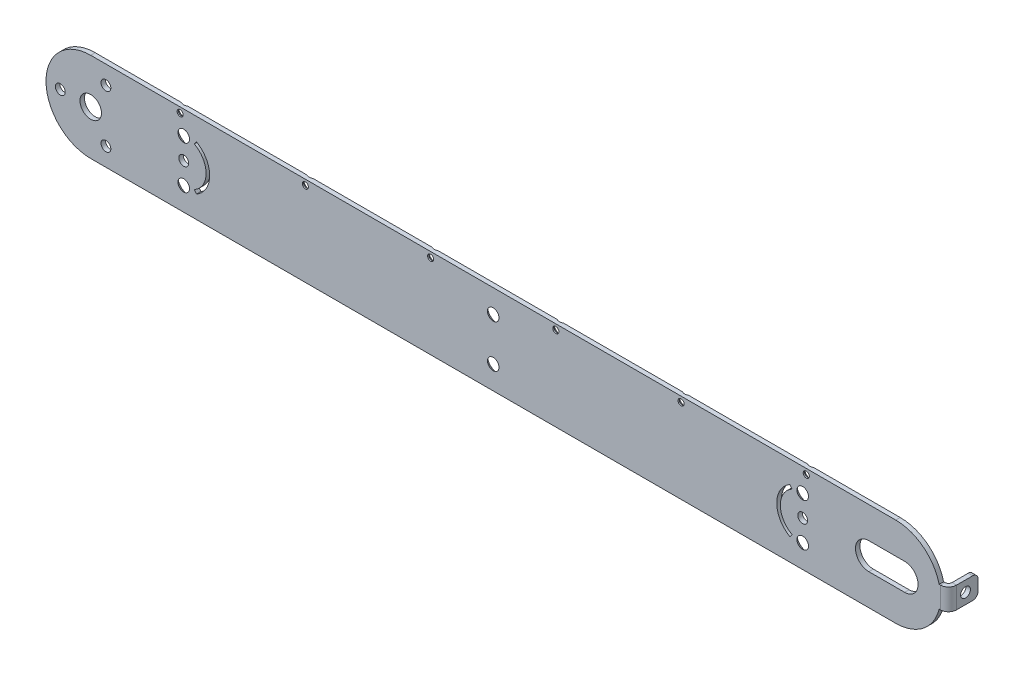
from build123d import *

# Parameters (mm, degrees)
AUFSATZ_LINEAR_START                        = -96.5
AUFSATZ_LINEAR_AUSTRAGEN1_DEPTH             = 2.5
SKIZZE3_W                                   = 2.5
SKIZZE3_H                                   = 6
AUFSATZ_LINEAR_AUSTRAGEN2_DEPTH             = 14
VERRUNDUNG1_R                               = 3
DURCHGANGSLOCH_F_R_M51_D                    = 5.5
KREISMUSTER1_COUNT                          = 3
DURCHGANGSLOCH_F_R_M5_EINSTELLSCHRAUBE_D    = 5.5
VOLUMENK_RPER_START                         = -6
VOLUMENK_RPER_UMWANDELN2_DEPTH              = 12
VOLUMENK_RPER_UMWANDELN2_2_DEPTH            = 12
FORMSENKUNG_F_R_M3_SENKSCHRAUBE_MIT_2_COUNT = 2
FORMSENKUNG_F_R_M3_SENKSCHRAUBE_MIT_2_PITCH = 70
FORMSENKUNG_F_R_M3_SENKSCHRAUBE_MIT_3_COUNT = 2
FORMSENKUNG_F_R_M3_SENKSCHRAUBE_MIT_3_PITCH = 140
FORMSENKUNG_F_R_M3_SENKSCHRAUBE_MIT_4_COUNT = 2
FORMSENKUNG_F_R_M3_SENKSCHRAUBE_MIT_4_PITCH = 210
FORMSENKUNG_F_R_M3_SENKSCHRAUBE_MIT_5_COUNT = 2
FORMSENKUNG_F_R_M3_SENKSCHRAUBE_MIT_5_PITCH = 280
FORMSENKUNG_F_R_M3_SENKSCHRAUBE_MIT_6_COUNT = 2
FORMSENKUNG_F_R_M3_SENKSCHRAUBE_MIT_6_PITCH = 350
FORMSENKUNG_F_R_M5_SENKSCHRAUBE_MIT_2_COUNT = 2
FORMSENKUNG_F_R_M5_SENKSCHRAUBE_MIT_2_PITCH = 173
DURCHGANGSLOCH_F_R_M52_D                    = 5.5
SCHNITT_LINEAR_AUSTRAGEN1_REACH             = 482.355


# Read off the part's stored shape, not the designer's step: Volumenkörper umwandeln2
with BuildPart() as part:
    # Skizze1 → Aufsatz-Linear austragen1 (new body)
    with BuildSketch(Plane.XY.offset(AUFSATZ_LINEAR_START)):
        with BuildLine():
            Line((462.5, 0), (475, 0))
            Line((475, 0), (477, 0))
            Line((477, 0), (479.5, 0))
            Line((479.5, 0), (479.5, 6))
            Line((479.5, 6), (474.269322199, 6))
            ThreePointArc((474.269322199, 6), (465.411035007, 19.685019685), (450, 25))
            Line((450, 25), (0, 25))
            ThreePointArc((0, 25), (-17.67766953, 17.67766953), (-25, 0))
            Line((-25, 0), (-6, 0))
            ThreePointArc((-6, 0), (0, 6), (6, 0))
            Line((6, 0), (427.5, 0))
            ThreePointArc((427.5, 0), (429.696699141, 5.303300859), (435, 7.5))
            Line((435, 7.5), (450, 7.5))
            Line((450, 7.5), (455, 7.5))
            ThreePointArc((455, 7.5), (460.303300859, 5.303300859), (462.5, 0))
        make_face()
    extrude(amount=-AUFSATZ_LINEAR_AUSTRAGEN1_DEPTH)

    # Skizze3 → Aufsatz-Linear austragen2 (add)
    with BuildSketch(Plane(origin=(0, 0, -99), x_dir=(-1, 0, 0), z_dir=(0, 0, -1))):
        with Locations((-478.25, 3)):
            Rectangle(SKIZZE3_W, SKIZZE3_H)
    extrude(amount=AUFSATZ_LINEAR_AUSTRAGEN2_DEPTH)

    # Verrundung1
    verrundung1_edges = [part.edges().sort_by_distance(p)[0] for p in [
        (478.25, 6, -113),
    ]]
    fillet(verrundung1_edges, radius=VERRUNDUNG1_R)

    # Spiegeln1: part across plane


with BuildPart() as part_1:
    add(part.part)
    add(part.part.mirror(Plane(origin=(6, 0, -99), x_dir=(0, 0, 1), z_dir=(0, -1, 0))))

    # Durchgangsloch für M51 (through all)
    with Locations(Plane(origin=(0, 0, -99), x_dir=(-1, 0, 0), z_dir=(0, 0, -1))):
        with Locations((17, 0)):
            durchgangsloch_f_r_m51 = Hole(DURCHGANGSLOCH_F_R_M51_D / 2)

    # Kreismuster1: Durchgangsloch für M51 ×3 about axis
    kreismuster1_axis = Axis((0, 0, 0), (0, 0, 1))
    for i in range(1, KREISMUSTER1_COUNT):
        add(durchgangsloch_f_r_m51.rotate(kreismuster1_axis, i * 360 / KREISMUSTER1_COUNT), mode=Mode.SUBTRACT)

    # Durchgangsloch für M5 Einstellschraube (through all)
    with Locations(Plane(origin=(479.5, 0, 0), x_dir=(0, 0, -1), z_dir=(1, 0, 0))):
        with Locations((106, 0)):
            Hole(DURCHGANGSLOCH_F_R_M5_EINSTELLSCHRAUBE_D / 2)

    # Volumenkörper umwandeln2 outline → Volumenkörper umwandeln2 (cut)
    with BuildSketch(Plane(origin=(0, 0, 0), x_dir=(1, 0, 0), z_dir=(0, 1, 0)).offset(VOLUMENK_RPER_START)):
        with BuildLine():
            Line((479.5, 96.5), (479.5, 101))
            ThreePointArc((479.5, 101), (478.181980515, 97.818019485), (475, 96.5))
            Line((475, 96.5), (479.5, 96.5))
        make_face()
    extrude(amount=VOLUMENK_RPER_UMWANDELN2_DEPTH, mode=Mode.SUBTRACT)

    # Volumenk_rper umwandeln2 2 outline → Volumenk_rper umwandeln2 2 (add)
    with BuildSketch(Plane(origin=(0, 0, 0), x_dir=(1, 0, 0), z_dir=(0, 1, 0)).offset(VOLUMENK_RPER_START)):
        with BuildLine():
            Line((477, 99), (477, 101))
            ThreePointArc((477, 101), (476.414213562, 99.585786438), (475, 99))
            Line((475, 99), (477, 99))
        make_face()
    extrude(amount=VOLUMENK_RPER_UMWANDELN2_2_DEPTH)

    # Skizze13 → Formsenkung für M3 Senkschraube mit Innensechskant1 (revolve, cut)
    with BuildSketch(Plane(origin=(400, 22, -99), x_dir=(0, 1, 0), z_dir=(1, 0, 0))):
        Polygon((0, 0), (0, 2.5), (1.7, 2.5), (1.7, 1.77), (3.47, 0), align=None)
    formsenkung_f_r_m3_senkschraube_mit_inne = revolve(axis=Axis((400, 22, -105.35), (0, 0, 1)), mode=Mode.SUBTRACT)

    # Formsenkung f_r M3 Senkschraube mit  2: Formsenkung für M3 Senkschraube mit Innensechskant1 ×2
    with Locations(*[(-i * FORMSENKUNG_F_R_M3_SENKSCHRAUBE_MIT_2_PITCH, 0, 0) for i in range(1, FORMSENKUNG_F_R_M3_SENKSCHRAUBE_MIT_2_COUNT)]):
        add(formsenkung_f_r_m3_senkschraube_mit_inne, mode=Mode.SUBTRACT)

    # Formsenkung f_r M3 Senkschraube mit  3: Formsenkung für M3 Senkschraube mit Innensechskant1 ×2
    with Locations(*[(-i * FORMSENKUNG_F_R_M3_SENKSCHRAUBE_MIT_3_PITCH, 0, 0) for i in range(1, FORMSENKUNG_F_R_M3_SENKSCHRAUBE_MIT_3_COUNT)]):
        add(formsenkung_f_r_m3_senkschraube_mit_inne, mode=Mode.SUBTRACT)

    # Formsenkung f_r M3 Senkschraube mit  4: Formsenkung für M3 Senkschraube mit Innensechskant1 ×2
    with Locations(*[(-i * FORMSENKUNG_F_R_M3_SENKSCHRAUBE_MIT_4_PITCH, 0, 0) for i in range(1, FORMSENKUNG_F_R_M3_SENKSCHRAUBE_MIT_4_COUNT)]):
        add(formsenkung_f_r_m3_senkschraube_mit_inne, mode=Mode.SUBTRACT)

    # Formsenkung f_r M3 Senkschraube mit  5: Formsenkung für M3 Senkschraube mit Innensechskant1 ×2
    with Locations(*[(-i * FORMSENKUNG_F_R_M3_SENKSCHRAUBE_MIT_5_PITCH, 0, 0) for i in range(1, FORMSENKUNG_F_R_M3_SENKSCHRAUBE_MIT_5_COUNT)]):
        add(formsenkung_f_r_m3_senkschraube_mit_inne, mode=Mode.SUBTRACT)

    # Formsenkung f_r M3 Senkschraube mit  6: Formsenkung für M3 Senkschraube mit Innensechskant1 ×2
    with Locations(*[(-i * FORMSENKUNG_F_R_M3_SENKSCHRAUBE_MIT_6_PITCH, 0, 0) for i in range(1, FORMSENKUNG_F_R_M3_SENKSCHRAUBE_MIT_6_COUNT)]):
        add(formsenkung_f_r_m3_senkschraube_mit_inne, mode=Mode.SUBTRACT)

    # Skizze15 → Formsenkung für M5 Senkschraube mit Innensechskant1 (revolve, cut)
    with BuildSketch(Plane(origin=(52, 12, -99), x_dir=(0, 1, 0), z_dir=(1, 0, 0))):
        Polygon((0, 0), (0, 2.5), (2.75, 2.5), (2.75, 2.985), (5.735, 0), align=None)
    formsenkung_f_r_m5_senkschraube_mit_inne = revolve(axis=Axis((52, 12, -105.35), (0, 0, 1)), mode=Mode.SUBTRACT)

    # Formsenkung f_r M5 Senkschraube mit  2: Formsenkung für M5 Senkschraube mit Innensechskant1 ×2
    with Locations(*[(i * FORMSENKUNG_F_R_M5_SENKSCHRAUBE_MIT_2_PITCH, 0, 0) for i in range(1, FORMSENKUNG_F_R_M5_SENKSCHRAUBE_MIT_2_COUNT)]):
        add(formsenkung_f_r_m5_senkschraube_mit_inne, mode=Mode.SUBTRACT)

    # Spiegeln2: Formsenkung für M5 Senkschraube mit Innensechskant1 across plane
    add(formsenkung_f_r_m5_senkschraube_mit_inne.mirror(Plane(origin=(225, 0, 0), x_dir=(0, 0, 1), z_dir=(1, 0, 0))), mode=Mode.SUBTRACT)

    # Spiegeln2 copy 1 sketch → Spiegeln2 copy 1 (revolve, cut)
    with BuildSketch(Plane(origin=(225, 12, -99), x_dir=(0, 1, 0), z_dir=(-1, 0, 0))):
        Polygon((0, 0), (0, -2.5), (2.75, -2.5), (2.75, -2.985), (5.735, 0), align=None)
    revolve(axis=Axis((225, 12, -105.35), (0, 0, -1)), mode=Mode.SUBTRACT)

    # Spiegeln2 at the second plane: Formsenkung für M5 Senkschraube mit Innensechskant1 across plane
    add(formsenkung_f_r_m5_senkschraube_mit_inne.mirror(Plane.ZX), mode=Mode.SUBTRACT)

    # Spiegeln2 at the second plane copy 1 ske → Spiegeln2 at the second plane copy 1 (revolve, cut)
    with BuildSketch(Plane(origin=(225, -12, -99), x_dir=(0, -1, 0), z_dir=(1, 0, 0))):
        Polygon((0, 0), (0, -2.5), (2.75, -2.5), (2.75, -2.985), (5.735, 0), align=None)
    revolve(axis=Axis((225, -12, -105.35), (0, 0, -1)), mode=Mode.SUBTRACT)

    # Spiegeln2 at the second plane copy 2 ske → Spiegeln2 at the second plane copy 2 (revolve, cut)
    with BuildSketch(Plane(origin=(398, -12, -99), x_dir=(0, -1, 0), z_dir=(-1, 0, 0))):
        Polygon((0, 0), (0, 2.5), (2.75, 2.5), (2.75, 2.985), (5.735, 0), align=None)
    revolve(axis=Axis((398, -12, -105.35), (0, 0, 1)), mode=Mode.SUBTRACT)

    # Spiegeln2 at the second plane copy 3 ske → Spiegeln2 at the second plane copy 3 (revolve, cut)
    with BuildSketch(Plane(origin=(225, -12, -99), x_dir=(0, -1, 0), z_dir=(-1, 0, 0))):
        Polygon((0, 0), (0, 2.5), (2.75, 2.5), (2.75, 2.985), (5.735, 0), align=None)
    revolve(axis=Axis((225, -12, -105.35), (0, 0, 1)), mode=Mode.SUBTRACT)

    # Durchgangsloch für M52 (through all)
    with Locations(Plane(origin=(0, 0, -99), x_dir=(-1, 0, 0), z_dir=(0, 0, -1))):
        with Locations((-52, 0)):
            durchgangsloch_f_r_m52 = Hole(DURCHGANGSLOCH_F_R_M52_D / 2)

    # Skizze19 → Schnitt-Linear austragen1 (cut, up to next)
    with BuildSketch(Plane(origin=(0, 0, -99), x_dir=(-1, 0, 0), z_dir=(0, 0, -1)), mode=Mode.PRIVATE) as schnitt_linear_austragen1_sk1:
        with BuildLine():
            Line((-59.155963734, -12.611192768), (-57.924777873, -11.006680115))
            ThreePointArc((-57.924777873, -11.006680115), (-64.5, 0), (-57.924777873, 11.006680115))
            Line((-57.924777873, 11.006680115), (-59.155963734, 12.611192768))
            ThreePointArc((-59.155963734, 12.611192768), (-60.01066697, 12.086323457), (-60.827040721, 11.503623434))
            ThreePointArc((-60.827040721, 11.503623434), (-66.5, 0), (-60.827040721, -11.503623434))
            ThreePointArc((-60.827040721, -11.503623434), (-60.01066697, -12.086323457), (-59.155963734, -12.611192768))
        make_face()
    schnitt_linear_austragen1_tool1 = extrude(schnitt_linear_austragen1_sk1.sketch, amount=-SCHNITT_LINEAR_AUSTRAGEN1_REACH, mode=Mode.PRIVATE) & part_1.part
    schnitt_linear_austragen1 = schnitt_linear_austragen1_tool1.solids().sort_by_distance((59.86349, -11.864266, -99))[0]
    add(schnitt_linear_austragen1, mode=Mode.SUBTRACT)

    # Spiegeln3: Durchgangsloch für M52, Schnitt-Linear austragen1 across plane
    add(durchgangsloch_f_r_m52.mirror(Plane(origin=(225, 0, 0), x_dir=(0, 0, 1), z_dir=(1, 0, 0))), mode=Mode.SUBTRACT)
    add(schnitt_linear_austragen1.mirror(Plane(origin=(225, 0, 0), x_dir=(0, 0, 1), z_dir=(1, 0, 0))), mode=Mode.SUBTRACT)


solid = part_1.part
